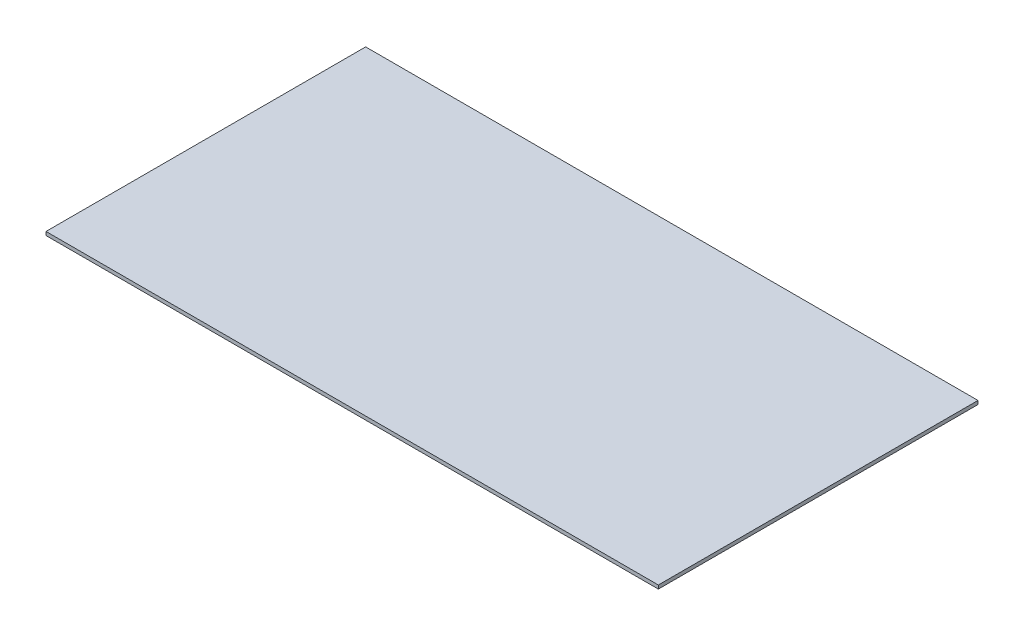
from build123d import *

# Parameters (mm, degrees)
SKETCH1_W           = 543.73
SKETCH1_H           = 3.175
BOSS_EXTRUDE1_DEPTH = 283.825
CUT_EXTRUDE1_DEPTH  = 1.3


with BuildPart() as part:
    # Sketch1 → Boss-Extrude1 (new body)
    with BuildSketch(Plane.XY):
        with Locations((-308.730031966, 1.266681686)):
            Rectangle(SKETCH1_W, SKETCH1_H)
    extrude(amount=BOSS_EXTRUDE1_DEPTH)

    # GasketGroove → Cut-Extrude1 (cut)
    with BuildSketch(Plane.XZ.offset(0.320818314)):
        with BuildLine():
            Line((-37.865031966, 2), (-37.865031966, 281.825))
            ThreePointArc((-37.865031966, 281.825), (-38.157925185, 282.532106781), (-38.865031966, 282.825))
            Line((-38.865031966, 282.825), (-578.595031966, 282.825))
            ThreePointArc((-578.595031966, 282.825), (-579.302138747, 282.532106781), (-579.595031966, 281.825))
            Line((-579.595031966, 281.825), (-579.595031966, 2))
            ThreePointArc((-579.595031966, 2), (-579.302138747, 1.292893219), (-578.595031966, 1))
            Line((-578.595031966, 1), (-38.865031966, 1))
            ThreePointArc((-38.865031966, 1), (-38.157925185, 1.292893219), (-37.865031966, 2))
        make_face()
        with BuildLine():
            Line((-577.595031966, 279.825), (-577.595031966, 4))
            ThreePointArc((-577.595031966, 4), (-577.302138747, 3.292893219), (-576.595031966, 3))
            Line((-576.595031966, 3), (-40.865031966, 3))
            ThreePointArc((-40.865031966, 3), (-40.157925185, 3.292893219), (-39.865031966, 4))
            Line((-39.865031966, 4), (-39.865031966, 279.825))
            ThreePointArc((-39.865031966, 279.825), (-40.157925185, 280.532106781), (-40.865031966, 280.825))
            Line((-40.865031966, 280.825), (-576.595031966, 280.825))
            ThreePointArc((-576.595031966, 280.825), (-577.302138747, 280.532106781), (-577.595031966, 279.825))
        make_face(mode=Mode.SUBTRACT)
    extrude(amount=-CUT_EXTRUDE1_DEPTH, mode=Mode.SUBTRACT)


solid = part.part
